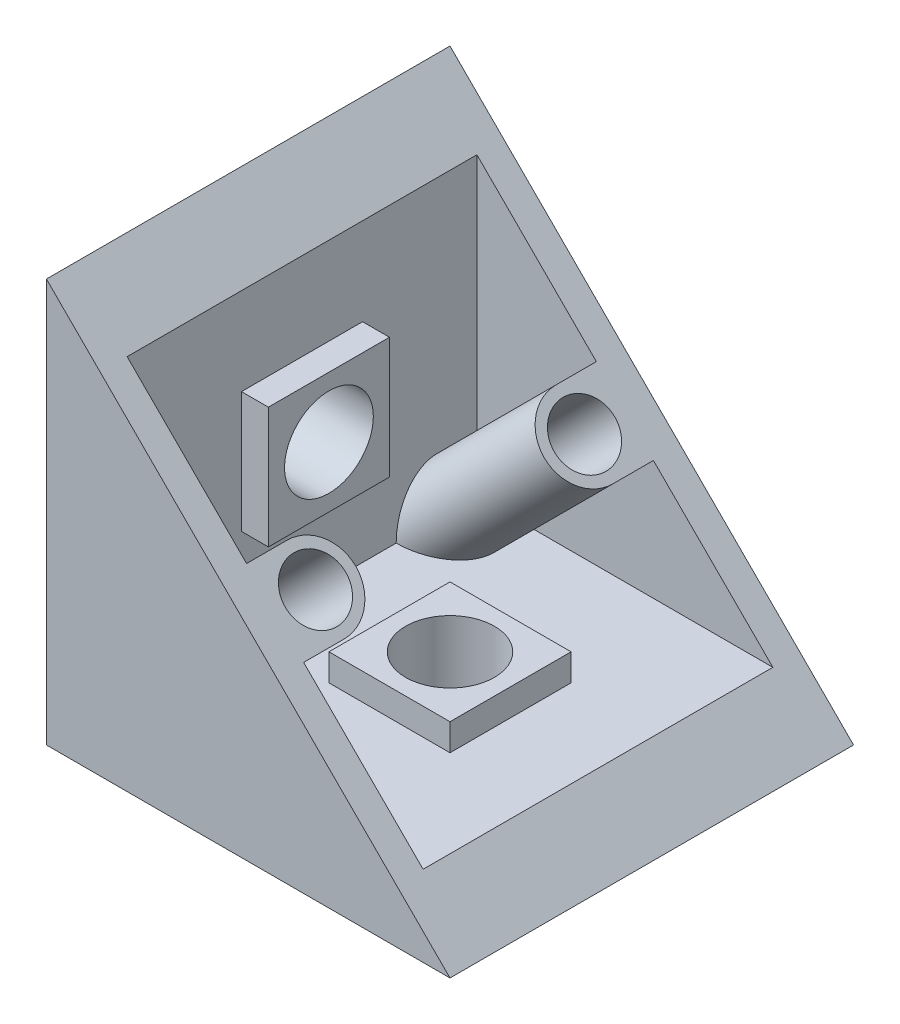
from build123d import *

# Parameters (mm, degrees)
BOSS_EXTRUDE1_DEPTH  = 30
SHELL1_START         = 4
SHELL1_OUTLINE_W     = 23
SHELL1_OUTLINE_H     = 26
SHELL1_DEPTH         = 22
SKETCH2_W            = 9
SKETCH2_H            = 9
BOSS_EXTRUDE2_DEPTH  = 2
SKETCH3_W            = 9
SKETCH3_H            = 9
BOSS_EXTRUDE3_DEPTH  = 2
BOSS_EXTRUDE4_START  = -15.556349
SKETCH4_R            = 2.25
BOSS_EXTRUDE4_DEPTH  = 15.556349
M6_CLEARANCE_HOLE2_D = 6.6
M6_CLEARANCE_HOLE3_D = 6.6


# Read off the part's stored shape, not the designer's step: Shell1
with BuildPart() as part:
    # Sketch1 → Boss-Extrude1 (new body)
    with BuildSketch(Plane.XY):
        Polygon((0, 0), (30, 0), (0, 30), align=None)
    extrude(amount=-BOSS_EXTRUDE1_DEPTH)

    # Shell1 outline → Shell1 (cut)
    with BuildSketch(Plane.YZ.offset(SHELL1_START)):
        with Locations((15.5, -15)):
            Rectangle(SHELL1_OUTLINE_W, SHELL1_OUTLINE_H)
    extrude(amount=SHELL1_DEPTH, mode=Mode.SUBTRACT)

    # Sketch2 → Boss-Extrude2 (add)
    with BuildSketch(Plane(origin=(0, 4, 0), x_dir=(1, 0, 0), z_dir=(0, 1, 0))):
        with Locations((15, 15)):
            Rectangle(SKETCH2_W, SKETCH2_H)
    extrude(amount=BOSS_EXTRUDE2_DEPTH)

    # Sketch3 → Boss-Extrude3 (add)
    with BuildSketch(Plane(origin=(4, 0, 0), x_dir=(0, 0, -1), z_dir=(1, 0, 0))):
        with Locations((15, 15)):
            Rectangle(SKETCH3_W, SKETCH3_H)
    extrude(amount=BOSS_EXTRUDE3_DEPTH)

    # Sketch4 → Boss-Extrude4 (add)
    # profile 1 of 2: a face of its own
    with BuildSketch(Plane(origin=(15, 15, 0), x_dir=(0, 0, -1), z_dir=(0.7071067811865477, 0.7071067811865475, 0)).offset(BOSS_EXTRUDE4_START)):
        with BuildLine():
            Line((2, 3), (2, -3))
            Line((2, -3), (5, -3))
            ThreePointArc((5, -3), (8, 0), (5, 3))
            Line((5, 3), (2, 3))
        make_face()
        with Locations(Location((5, 0, 0), (0, 0, 90))):
            Circle(SKETCH4_R, mode=Mode.SUBTRACT)
    # profile 2 of 2: a face of its own
    with BuildSketch(Plane(origin=(15, 15, 0), x_dir=(0, 0, -1), z_dir=(0.7071067811865477, 0.7071067811865475, 0)).offset(BOSS_EXTRUDE4_START)):
        with BuildLine():
            Line((25, -3), (28, -3))
            Line((28, -3), (28, 3))
            Line((28, 3), (25, 3))
            ThreePointArc((25, 3), (22, 0), (25, -3))
        make_face()
        with Locations(Location((25, 0, 0), (0, 0, 90))):
            Circle(SKETCH4_R, mode=Mode.SUBTRACT)
    extrude(amount=BOSS_EXTRUDE4_DEPTH)

    # M6 Clearance Hole2 (through all)
    with Locations(Plane(origin=(0, 6, 0), x_dir=(1, 0, 0), z_dir=(0, 1, 0))):
        with Locations((15, 15)):
            Hole(M6_CLEARANCE_HOLE2_D / 2)

    # M6 Clearance Hole3 (through all)
    with Locations(Plane(origin=(6, 0, 0), x_dir=(0, 0, -1), z_dir=(1, 0, 0))):
        with Locations((15, 15)):
            Hole(M6_CLEARANCE_HOLE3_D / 2)


solid = part.part
